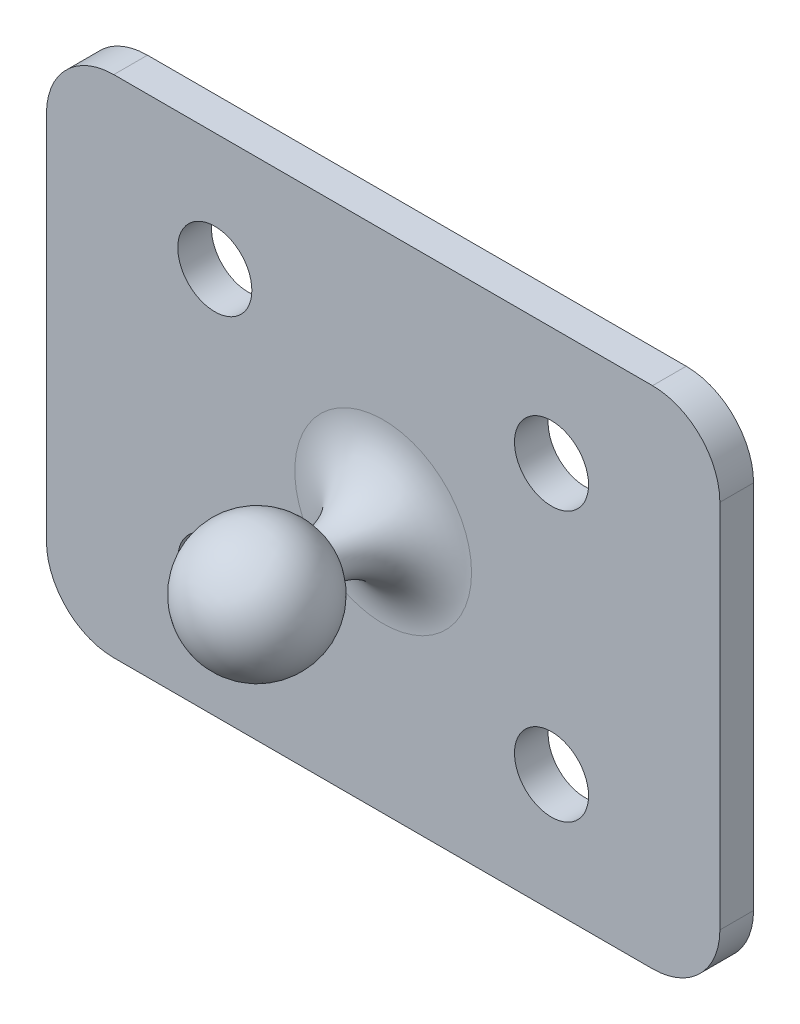
from build123d import *

# Parameters (mm, degrees)
BOSS_EXTRUDE1_DEPTH = 2.54
SKETCH2_R           = 2.794
CUT_EXTRUDE1_DEPTH  = 81.372038048
SKETCH3_R           = 1.5875
BOSS_EXTRUDE2_DEPTH = 9.525
FILLET1_R           = 5.08


with BuildPart() as part:
    # Sketch1 → Boss-Extrude1 (new body)
    with BuildSketch(Plane.XY):
        with BuildLine():
            Line((16.51, -12.7), (57.15, -12.7))
            ThreePointArc((57.15, -12.7), (60.742102448, -14.187897552), (62.23, -17.78))
            Line((62.23, -17.78), (62.23, -45.72))
            ThreePointArc((62.23, -45.72), (60.742102448, -49.312102448), (57.15, -50.8))
            Line((57.15, -50.8), (16.51, -50.8))
            ThreePointArc((16.51, -50.8), (12.917897552, -49.312102448), (11.43, -45.72))
            Line((11.43, -45.72), (11.43, -17.78))
            ThreePointArc((11.43, -17.78), (12.917897552, -14.187897552), (16.51, -12.7))
        make_face()
    extrude(amount=BOSS_EXTRUDE1_DEPTH)

    # Sketch2 → Cut-Extrude1 (cut, through all)
    with BuildSketch(Plane.XY.offset(2.54)):
        with Locations((24.13, -21.59)):
            Circle(SKETCH2_R)
        with Locations((49.53, -21.59)):
            Circle(SKETCH2_R)
        with Locations((24.13, -41.91)):
            Circle(SKETCH2_R)
        with Locations((49.53, -41.91)):
            Circle(SKETCH2_R)
    extrude(amount=-CUT_EXTRUDE1_DEPTH, mode=Mode.SUBTRACT)

    # Sketch3 → Boss-Extrude2 (add)
    with BuildSketch(Plane.XY.offset(2.54)):
        with Locations((36.83, -31.75)):
            Circle(SKETCH3_R)
    extrude(amount=BOSS_EXTRUDE2_DEPTH)

    # Fillet1
    fillet1_edges = [part.edges().sort_by_distance(p)[0] for p in [
        (35.2425, -31.75, 2.54),
    ]]
    fillet(fillet1_edges, radius=FILLET1_R)

    # Sketch5 → Revolve1 (revolve)
    with BuildSketch(Plane.XY.offset(12.065)):
        with BuildLine():
            Line((36.83, -26.9875), (36.83, -36.5125))
            ThreePointArc((36.83, -36.5125), (32.0675, -31.75), (36.83, -26.9875))
        make_face()
    revolve(axis=Axis((36.83, -30.1625, 12.065), (0, -1, 0)))


solid = part.part
